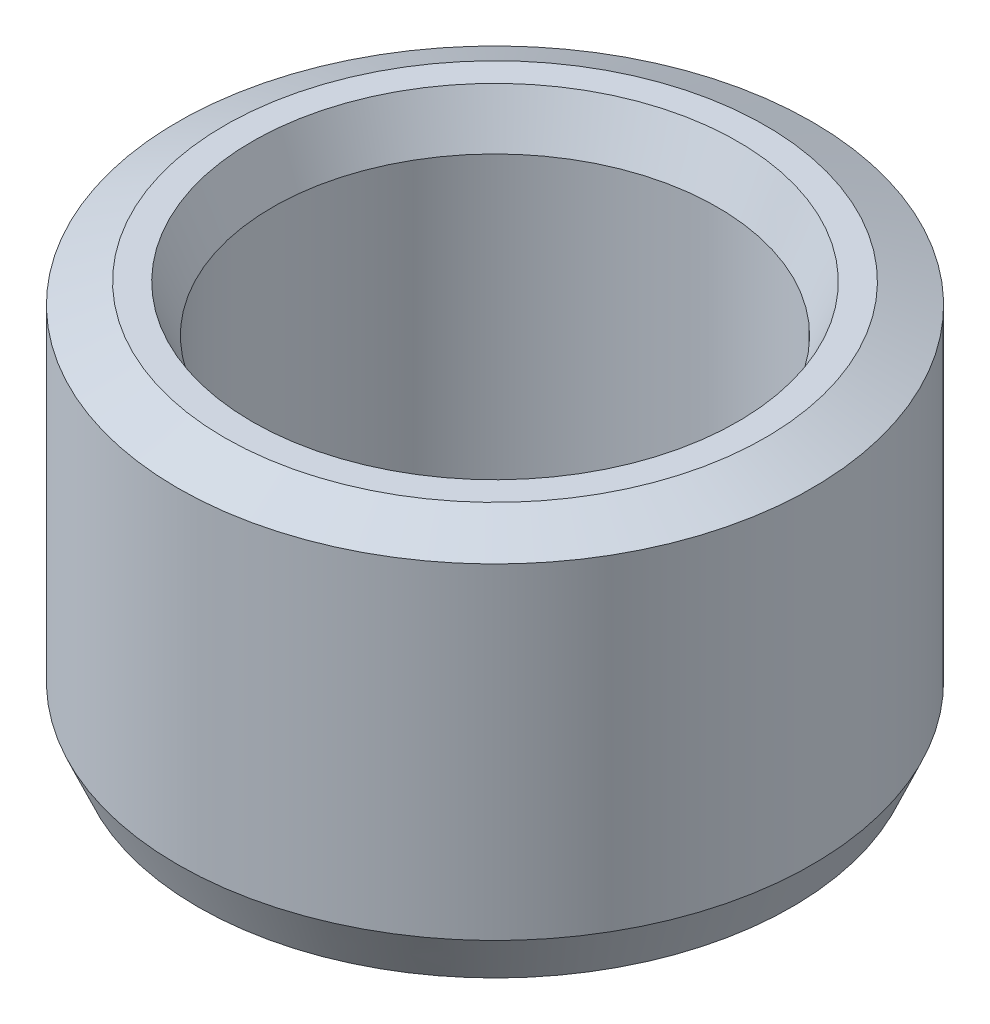
from build123d import *
from OCP.BRepFilletAPI import BRepFilletAPI_MakeChamfer

# Parameters (mm, degrees)
SKETCH1_R           = 37.5
BOSS_EXTRUDE1_DEPTH = 46.474819033
SKETCH2_R           = 26.300496664
CUT_EXTRUDE1_DEPTH  = 71.515309005
CHAMFER1_SIZE       = 2.396643912
CHAMFER1_SIZE2      = 5.531931245


with BuildPart() as part:
    # Sketch1 → Boss-Extrude1 (new body)
    with BuildSketch(Plane(origin=(0, 0, 0), x_dir=(1, 0, 0), z_dir=(0, 1, 0))):
        Circle(SKETCH1_R)
    extrude(amount=BOSS_EXTRUDE1_DEPTH)

    # Sketch2 → Cut-Extrude1 (cut, through all)
    with BuildSketch(Plane(origin=(0, 0, 0), x_dir=(1, 0, 0), z_dir=(0, 1, 0))):
        Circle(SKETCH2_R)
    extrude(amount=CUT_EXTRUDE1_DEPTH, mode=Mode.SUBTRACT)

    # Chamfer1: one chamfer whose edges measure the first distance from different faces: ONE call of the kernel's chamfer builder (chamfer() names one face for all edges)
    chamfer1_edges_1 = [part.edges().sort_by_distance(p)[0] for p in [
        (-26.300496664, 46.474819033, 0),
    ]]
    chamfer1_side_1 = [part.faces().sort_by_distance(p)[0] for p in [
        (-36.439339828, 46.474819033, 0),
    ]]
    chamfer1_edges_2 = [part.edges().sort_by_distance(p)[0] for p in [
        (-26.300496664, 0, 0),
    ]]
    chamfer1_side_2 = [part.faces().sort_by_distance(p)[0] for p in [
        (-26.300496664, 23.237409516, 0),
    ]]
    chamfer1_edges_3 = [part.edges().sort_by_distance(p)[0] for p in [
        (-37.5, 0, 0),
    ]]
    chamfer1_side_3 = [part.faces().sort_by_distance(p)[0] for p in [
        (-36.439339828, 0, 0),
    ]]
    chamfer1_edges_4 = [part.edges().sort_by_distance(p)[0] for p in [
        (-37.5, 46.474819033, 0),
    ]]
    chamfer1_side_4 = [part.faces().sort_by_distance(p)[0] for p in [
        (-37.5, 23.237409516, 0),
    ]]
    chamfer1 = BRepFilletAPI_MakeChamfer(part.part.solid().wrapped)
    for e in chamfer1_edges_1:
        chamfer1.Add(CHAMFER1_SIZE, CHAMFER1_SIZE2, e.wrapped, chamfer1_side_1[0].wrapped)  # the first distance lies on this face
    for e in chamfer1_edges_2:
        chamfer1.Add(CHAMFER1_SIZE, CHAMFER1_SIZE2, e.wrapped, chamfer1_side_2[0].wrapped)  # the first distance lies on this face
    for e in chamfer1_edges_3:
        chamfer1.Add(CHAMFER1_SIZE, CHAMFER1_SIZE2, e.wrapped, chamfer1_side_3[0].wrapped)  # the first distance lies on this face
    for e in chamfer1_edges_4:
        chamfer1.Add(CHAMFER1_SIZE, CHAMFER1_SIZE2, e.wrapped, chamfer1_side_4[0].wrapped)  # the first distance lies on this face
    add(Compound.cast(chamfer1.Shape()), mode=Mode.REPLACE)


solid = part.part
